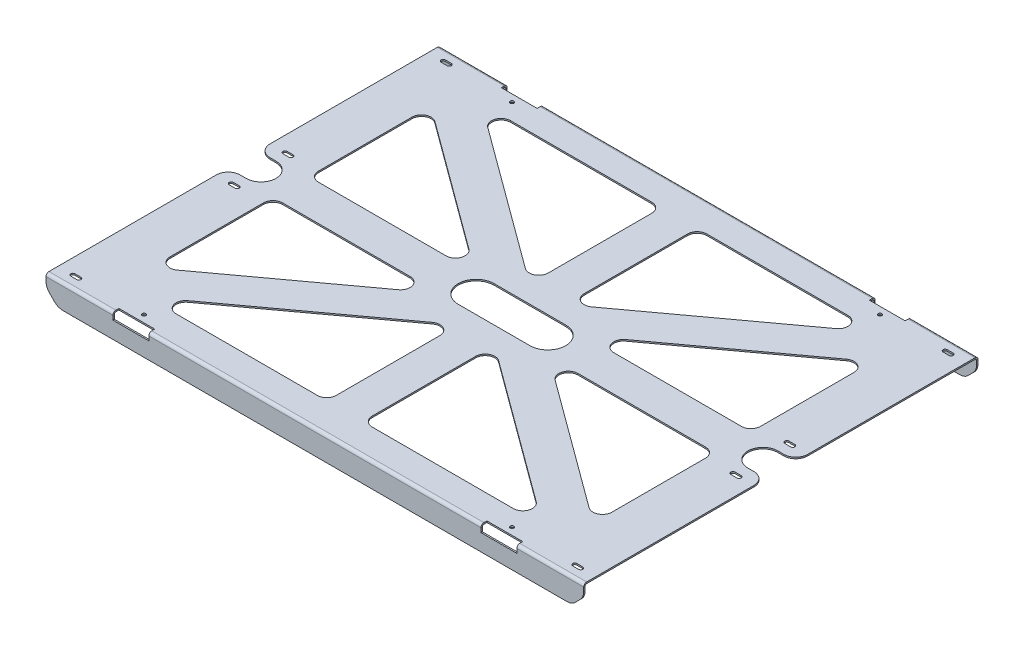
from build123d import *

# Parameters (mm, degrees)
BASE_FLANGE1_DEPTH             = 1.21412
EDGE_FLANGE1_STRIP_W           = 7.39648
EDGE_FLANGE1_STRIP_H           = 1.21412
EDGE_FLANGE1_STRIP_CUT_DEPTH   = 450
EDGE_FLANGE1_STRIP_2_W         = 7.39648
EDGE_FLANGE1_STRIP_2_H         = 1.21412
EDGE_FLANGE1_STRIP_CUT_2_DEPTH = 450
EDGE_FLANGE1_DEPTH             = 450
EDGE_FLANGE1_BEND_DEPTH        = 450
CHAMFER1_SIZE                  = 10
FILLET1_R                      = 10
SKETCH12_R                     = 1.55
CUT_EXTRUDE1_DEPTH             = 1.21412
SKETCH13_W                     = 30
SKETCH13_H                     = 12
CUT_EXTRUDE2_DEPTH             = 5


# Sheet-metal steps are written as plain solids
with BuildPart() as part:
    # Sketch1 → Base-Flange1 (new body)
    with BuildSketch(Plane(origin=(0, 0, 0), x_dir=(1, 0, 0), z_dir=(0, 1, 0))):
        with BuildLine():
            Line((-225, -165), (225, -165))
            Line((225, -165), (225, -22.5))
            ThreePointArc((225, -22.5), (222.071067812, -15.428932188), (215, -12.5))
            Line((215, -12.5), (210, -12.5))
            ThreePointArc((210, -12.5), (197.5, 0), (210, 12.5))
            Line((210, 12.5), (215, 12.5))
            ThreePointArc((215, 12.5), (222.071067812, 15.428932188), (225, 22.5))
            Line((225, 22.5), (225, 165))
            Line((225, 165), (-225, 165))
            Line((-225, 165), (-225, 22.5))
            ThreePointArc((-225, 22.5), (-222.071067812, 15.428932188), (-215, 12.5))
            Line((-215, 12.5), (-210, 12.5))
            ThreePointArc((-210, 12.5), (-197.5, 0), (-210, -12.5))
            Line((-210, -12.5), (-215, -12.5))
            ThreePointArc((-215, -12.5), (-222.071067812, -15.428932188), (-225, -22.5))
            Line((-225, -22.5), (-225, -165))
        make_face()
        with BuildLine():
            Line((-15, 132), (-15, 45.388315365))
            ThreePointArc((-15, 45.388315365), (-19.38387462, 38.252235402), (-27.730909309, 38.937075398))
            Line((-27.730909309, 38.937075398), (-145.837751994, 125.548760033))
            ThreePointArc((-145.837751994, 125.548760033), (-148.709799995, 134.488983755), (-141.106842685, 140))
            Line((-141.106842685, 140), (-23, 140))
            ThreePointArc((-23, 140), (-17.343145751, 137.656854249), (-15, 132))
        make_face(mode=Mode.SUBTRACT)
        with BuildLine():
            Line((-172.269090691, 107.729591269), (-65.52588437, 29.451239967))
            ThreePointArc((-65.52588437, 29.451239967), (-62.653836368, 20.511016245), (-70.256793679, 15))
            Line((-70.256793679, 15), (-177, 15))
            ThreePointArc((-177, 15), (-182.656854249, 17.343145751), (-185, 23))
            Line((-185, 23), (-185, 101.278351302))
            ThreePointArc((-185, 101.278351302), (-180.61612538, 108.414431265), (-172.269090691, 107.729591269))
        make_face(mode=Mode.SUBTRACT)
        with BuildLine():
            Line((177, 15), (70.256793679, 15))
            ThreePointArc((70.256793679, 15), (62.653836368, 20.511016245), (65.52588437, 29.451239967))
            Line((65.52588437, 29.451239967), (172.269090691, 107.729591269))
            ThreePointArc((172.269090691, 107.729591269), (180.61612538, 108.414431265), (185, 101.278351302))
            Line((185, 101.278351302), (185, 23))
            ThreePointArc((185, 23), (182.656854249, 17.343145751), (177, 15))
        make_face(mode=Mode.SUBTRACT)
        with BuildLine():
            Line((145.837751994, 125.548760033), (27.730909309, 38.937075398))
            ThreePointArc((27.730909309, 38.937075398), (19.38387462, 38.252235402), (15, 45.388315365))
            Line((15, 45.388315365), (15, 132))
            ThreePointArc((15, 132), (17.343145751, 137.656854249), (23, 140))
            Line((23, 140), (141.106842685, 140))
            ThreePointArc((141.106842685, 140), (148.709799995, 134.488983755), (145.837751994, 125.548760033))
        make_face(mode=Mode.SUBTRACT)
        with BuildLine():
            Line((-177, -15), (-70.256793679, -15))
            ThreePointArc((-70.256793679, -15), (-62.653836368, -20.511016245), (-65.52588437, -29.451239967))
            Line((-65.52588437, -29.451239967), (-172.269090691, -107.729591269))
            ThreePointArc((-172.269090691, -107.729591269), (-180.61612538, -108.414431265), (-185, -101.278351302))
            Line((-185, -101.278351302), (-185, -23))
            ThreePointArc((-185, -23), (-182.656854249, -17.343145751), (-177, -15))
        make_face(mode=Mode.SUBTRACT)
        with BuildLine():
            Line((-15, -132), (-15, -45.388315365))
            ThreePointArc((-15, -45.388315365), (-19.38387462, -38.252235402), (-27.730909309, -38.937075398))
            Line((-27.730909309, -38.937075398), (-145.837751994, -125.548760033))
            ThreePointArc((-145.837751994, -125.548760033), (-148.709799995, -134.488983755), (-141.106842685, -140))
            Line((-141.106842685, -140), (-23, -140))
            ThreePointArc((-23, -140), (-17.343145751, -137.656854249), (-15, -132))
        make_face(mode=Mode.SUBTRACT)
        with BuildLine():
            Line((15, -132), (15, -45.388315365))
            ThreePointArc((15, -45.388315365), (19.38387462, -38.252235402), (27.730909309, -38.937075398))
            Line((27.730909309, -38.937075398), (145.837751994, -125.548760033))
            ThreePointArc((145.837751994, -125.548760033), (148.709799995, -134.488983755), (141.106842685, -140))
            Line((141.106842685, -140), (23, -140))
            ThreePointArc((23, -140), (17.343145751, -137.656854249), (15, -132))
        make_face(mode=Mode.SUBTRACT)
        with BuildLine():
            Line((172.269090691, -107.729591269), (65.52588437, -29.451239967))
            ThreePointArc((65.52588437, -29.451239967), (62.653836368, -20.511016245), (70.256793679, -15))
            Line((70.256793679, -15), (177, -15))
            ThreePointArc((177, -15), (182.656854249, -17.343145751), (185, -23))
            Line((185, -23), (185, -101.278351302))
            ThreePointArc((185, -101.278351302), (180.61612538, -108.414431265), (172.269090691, -107.729591269))
        make_face(mode=Mode.SUBTRACT)
        with BuildLine():
            Line((-30, 15), (30, 15))
            ThreePointArc((30, 15), (45, 0), (30, -15))
            Line((30, -15), (-30, -15))
            ThreePointArc((-30, -15), (-45, 0), (-30, 15))
        make_face(mode=Mode.SUBTRACT)
        with BuildLine():
            Line((-212.5, 156.75), (-207.5, 156.75))
            ThreePointArc((-207.5, 156.75), (-205.75, 155), (-207.5, 153.25))
            Line((-207.5, 153.25), (-212.5, 153.25))
            ThreePointArc((-212.5, 153.25), (-214.25, 155), (-212.5, 156.75))
        make_face(mode=Mode.SUBTRACT)
        with BuildLine():
            Line((-212.5, -156.75), (-207.5, -156.75))
            ThreePointArc((-207.5, -156.75), (-205.75, -155), (-207.5, -153.25))
            Line((-207.5, -153.25), (-212.5, -153.25))
            ThreePointArc((-212.5, -153.25), (-214.25, -155), (-212.5, -156.75))
        make_face(mode=Mode.SUBTRACT)
        with BuildLine():
            Line((212.5, -156.75), (207.5, -156.75))
            ThreePointArc((207.5, -156.75), (205.75, -155), (207.5, -153.25))
            Line((207.5, -153.25), (212.5, -153.25))
            ThreePointArc((212.5, -153.25), (214.25, -155), (212.5, -156.75))
        make_face(mode=Mode.SUBTRACT)
        with BuildLine():
            Line((-212.5, 24.25), (-207.5, 24.25))
            ThreePointArc((-207.5, 24.25), (-205.75, 22.5), (-207.5, 20.75))
            Line((-207.5, 20.75), (-212.5, 20.75))
            ThreePointArc((-212.5, 20.75), (-214.25, 22.5), (-212.5, 24.25))
        make_face(mode=Mode.SUBTRACT)
        with BuildLine():
            Line((212.5, 156.75), (207.5, 156.75))
            ThreePointArc((207.5, 156.75), (205.75, 155), (207.5, 153.25))
            Line((207.5, 153.25), (212.5, 153.25))
            ThreePointArc((212.5, 153.25), (214.25, 155), (212.5, 156.75))
        make_face(mode=Mode.SUBTRACT)
        with BuildLine():
            Line((-212.5, -20.75), (-207.5, -20.75))
            ThreePointArc((-207.5, -20.75), (-205.75, -22.5), (-207.5, -24.25))
            Line((-207.5, -24.25), (-212.5, -24.25))
            ThreePointArc((-212.5, -24.25), (-214.25, -22.5), (-212.5, -20.75))
        make_face(mode=Mode.SUBTRACT)
        with BuildLine():
            Line((207.5, 24.25), (212.5, 24.25))
            ThreePointArc((212.5, 24.25), (214.25, 22.5), (212.5, 20.75))
            Line((212.5, 20.75), (207.5, 20.75))
            ThreePointArc((207.5, 20.75), (205.75, 22.5), (207.5, 24.25))
        make_face(mode=Mode.SUBTRACT)
        with BuildLine():
            Line((207.5, -20.75), (212.5, -20.75))
            ThreePointArc((212.5, -20.75), (214.25, -22.5), (212.5, -24.25))
            Line((212.5, -24.25), (207.5, -24.25))
            ThreePointArc((207.5, -24.25), (205.75, -22.5), (207.5, -20.75))
        make_face(mode=Mode.SUBTRACT)
    extrude(amount=-BASE_FLANGE1_DEPTH)

    # Edge-Flange1 strip (across the edge) → Edge-Flange1 strip cut (cut)
    with BuildSketch(Plane(origin=(225, -1.21412, 165), x_dir=(0, 0, -1), z_dir=(-1, 0, 0))):
        with Locations((-1.21412, -0.60706)):
            Rectangle(EDGE_FLANGE1_STRIP_W, EDGE_FLANGE1_STRIP_H)
    extrude(amount=EDGE_FLANGE1_STRIP_CUT_DEPTH, mode=Mode.SUBTRACT)

    # Edge-Flange1 strip 2 (across the edge) → Edge-Flange1 strip cut 2 (cut)
    with BuildSketch(Plane(origin=(-225, -1.21412, -165), x_dir=(0, 0, 1), z_dir=(1, 0, 0))):
        with Locations((-1.21412, -0.60706)):
            Rectangle(EDGE_FLANGE1_STRIP_2_W, EDGE_FLANGE1_STRIP_2_H)
    extrude(amount=EDGE_FLANGE1_STRIP_CUT_2_DEPTH, mode=Mode.SUBTRACT)

    # Edge-Flange1 section (across the edge) → Edge-Flange1 (add)
    with BuildSketch(Plane(origin=(225, -1.21412, 165), x_dir=(0, 0, -1), z_dir=(-1, 0, 0))):
        with BuildLine():
            Line((0, 1.27), (0, 18.78588))
            Line((0, 18.78588), (1.21412, 18.78588))
            Line((1.21412, 18.78588), (1.21412, 1.27))
            ThreePointArc((1.21412, 1.27), (1.586094388, 0.371974388), (2.48412, 0))
            Line((2.48412, 0), (2.48412, -1.21412))
            ThreePointArc((2.48412, -1.21412), (0.727581903, -0.486538097), (0, 1.27))
        make_face()
    extrude(amount=EDGE_FLANGE1_DEPTH)

    # Edge-Flange1 section 2 (across the edge) → Edge-Flange1 bend (add)
    with BuildSketch(Plane(origin=(-225, -1.21412, -165), x_dir=(0, 0, 1), z_dir=(1, 0, 0))):
        with BuildLine():
            Line((0, 1.27), (0, 18.78588))
            Line((0, 18.78588), (1.21412, 18.78588))
            Line((1.21412, 18.78588), (1.21412, 1.27))
            ThreePointArc((1.21412, 1.27), (1.586094388, 0.371974388), (2.48412, 0))
            Line((2.48412, 0), (2.48412, -1.21412))
            ThreePointArc((2.48412, -1.21412), (0.727581903, -0.486538097), (0, 1.27))
        make_face()
    extrude(amount=EDGE_FLANGE1_BEND_DEPTH)

    # Chamfer1
    chamfer1_edges = [part.edges().sort_by_distance(p)[0] for p in [
        (225, -20, 164.39294),
        (-225, -20, 164.39294),
        (-225, -20, -164.39294),
        (225, -20, -164.39294),
    ]]
    chamfer(chamfer1_edges, length=CHAMFER1_SIZE)

    # Fillet1
    fillet1_edges = [part.edges().sort_by_distance(p)[0] for p in [
        (-215, -20, -164.39294),
        (215, -20, -164.39294),
        (225, -10, -164.39294),
        (-225, -10, -164.39294),
        (215, -20, 164.39294),
        (-215, -20, 164.39294),
        (-225, -10, 164.39294),
        (225, -10, 164.39294),
    ]]
    fillet(fillet1_edges, radius=FILLET1_R)

    # Sketch12 → Cut-Extrude1 (cut)
    with BuildSketch(Plane(origin=(0, 0, 0), x_dir=(1, 0, 0), z_dir=(0, 1, 0))):
        with Locations(Location((154, -154, 0), (0, 0, 270))):
            Circle(SKETCH12_R)
        with Locations(Location((-154, -154, 0), (0, 0, 270))):
            Circle(SKETCH12_R)
        with Locations(Location((-154, 154, 0), (0, 0, 270))):
            Circle(SKETCH12_R)
        with Locations(Location((154, 154, 0), (0, 0, 270))):
            Circle(SKETCH12_R)
    extrude(amount=-CUT_EXTRUDE1_DEPTH, mode=Mode.SUBTRACT)

    # Sketch13 → Cut-Extrude2 (cut)
    with BuildSketch(Plane.XY.offset(165)):
        with Locations((-154, 0)):
            Rectangle(SKETCH13_W, SKETCH13_H)
        with Locations((154, 0)):
            Rectangle(SKETCH13_W, SKETCH13_H)
    cut_extrude2 = extrude(amount=-CUT_EXTRUDE2_DEPTH, mode=Mode.SUBTRACT)

    # Mirror1: Cut-Extrude2 across plane
    add(cut_extrude2.mirror(Plane.XY), mode=Mode.SUBTRACT)


solid = part.part
